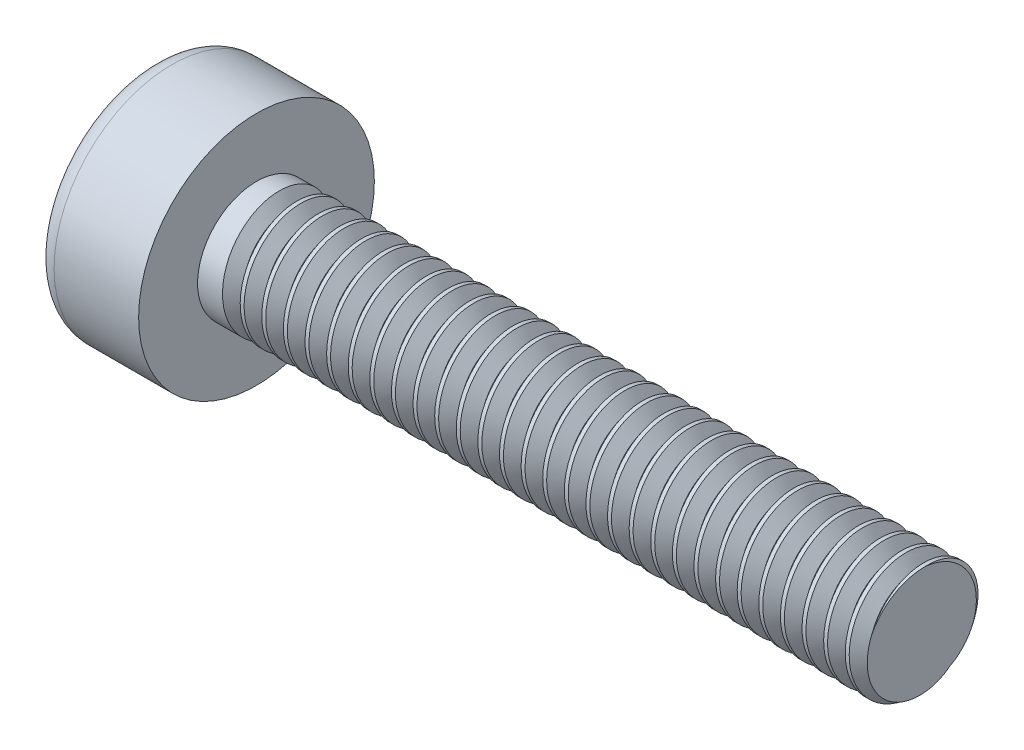
from build123d import *

# Parameters (mm, degrees)
CUT_EXTRUDE1_DEPTH = 3.5
CUT_EXTRUDE1_DRAFT = 10
CUT_SWEEP1_PITCH   = 1.1
FILLET2_R          = 1
CUT_EXTRUDE2_DEPTH = 3.5


with BuildPart() as part:
    # Sketch1 → Revolve1 (revolve)
    with BuildSketch(Plane.XY, mode=Mode.PRIVATE) as revolve1_sk:
        with BuildLine():
            Line((0, 3), (34, 3))
            Line((34, 3), (34, 0))
            Line((34, 0), (0, 0))
            Line((0, 0), (-5.5, 0))
            ThreePointArc((-5.5, 0), (-5.71228207, 3.038523506), (-5, 6))
            Line((-5, 6), (0, 6))
            Line((0, 6), (0, 3))
        make_face()
    revolve(revolve1_sk.sketch.rotate(Axis((34, 0, 0), (-1, 0, 0)), 90), axis=Axis((34, 0, 0), (-1, 0, 0)))


with BuildPart() as cut_extrude1_tool:
    # Sketch4 → Cut-Extrude1 (with draft: the straight prism first)
    with BuildSketch(Plane(origin=(-6, 0, 0), x_dir=(0, 0, -1), z_dir=(1, 0, 0))):
        with BuildLine():
            Line((-3.6, 0.71), (-3.6, -0.71))
            Line((-3.6, -0.71), (-1.433840995, -0.71))
            ThreePointArc((-1.433840995, -0.71), (-1.13137085, -1.13137085), (-0.71, -1.433840995))
            Line((-0.71, -1.433840995), (-0.71, -3.6))
            Line((-0.71, -3.6), (0.71, -3.6))
            Line((0.71, -3.6), (0.71, -1.433840995))
            ThreePointArc((0.71, -1.433840995), (1.13137085, -1.13137085), (1.433840995, -0.71))
            Line((1.433840995, -0.71), (3.6, -0.71))
            Line((3.6, -0.71), (3.6, 0.71))
            Line((3.6, 0.71), (1.433840995, 0.71))
            ThreePointArc((1.433840995, 0.71), (1.13137085, 1.13137085), (0.71, 1.433840995))
            Line((0.71, 1.433840995), (0.71, 3.6))
            Line((0.71, 3.6), (-0.71, 3.6))
            Line((-0.71, 3.6), (-0.71, 1.433840995))
            ThreePointArc((-0.71, 1.433840995), (-1.13137085, 1.13137085), (-1.433840995, 0.71))
            Line((-1.433840995, 0.71), (-3.6, 0.71))
        make_face()
    extrude(amount=CUT_EXTRUDE1_DEPTH)
    # Cut-Extrude1: the draft: its side faces are tilted about the plane it starts from
    cut_extrude1_sides = [cut_extrude1_tool.faces().sort_by_distance(p)[0] for p in [
        (-4.25, 0.71, 2.516920498),
        (-4.25, 0, 3.6),
        (-4.25, -0.71, 2.516920498),
        (-4.25, -1.13137085, 1.13137085),
        (-4.25, -2.516920498, 0.71),
        (-4.25, -3.6, 0),
        (-4.25, -2.516920498, -0.71),
        (-4.25, -1.13137085, -1.13137085),
        (-4.25, -0.71, -2.516920498),
        (-4.25, 0, -3.6),
        (-4.25, 0.71, -2.516920498),
        (-4.25, 1.13137085, -1.13137085),
        (-4.25, 2.516920498, -0.71),
        (-4.25, 3.6, 0),
        (-4.25, 2.516920498, 0.71),
        (-4.25, 1.13137085, 1.13137085),
    ]]
    draft(cut_extrude1_sides, Plane(origin=(-6, 0, 0), x_dir=(0, 0, -1), z_dir=(1, 0, 0)), CUT_EXTRUDE1_DRAFT)


with BuildPart() as part_1:
    add(part.part)

    # Cut-Extrude1: cut by cut_extrude1_tool
    add(cut_extrude1_tool.part, mode=Mode.SUBTRACT)

    # Cut-Sweep1: the profile of Sketch6 profile screwed along a right-hand helix of 30.454545 turns, 8 arcs to a turn; built about Z, then put on its axis
    cut_sweep1_z = Axis((0, 0, 0), (0, 0, 1))
    cut_sweep1_corners = [(3.0003, 0, 0.000225), (3.0003, 0, -0.900225), (2.4, 0, -0.45)]
    with BuildLine(mode=Mode.PRIVATE) as cut_sweep1_profile:
        Line(cut_sweep1_corners[0], cut_sweep1_corners[1])
        Line(cut_sweep1_corners[1], cut_sweep1_corners[2])
        Line(cut_sweep1_corners[2], cut_sweep1_corners[0])
    cut_sweep1_cap = Face(cut_sweep1_profile.wire())
    cut_sweep1_turn_angles = [0, 22.5, 45, 67.5, 90, 112.5, 135, 157.5, 180, 202.5, 225, 247.5, 270, 292.5, 315, 337.5, 360]
    cut_sweep1_turn_weights = [1, 0.9238795325112867, 1, 0.9238795325112867, 1, 0.9238795325112867, 1, 0.9238795325112867, 1, 0.9238795325112867, 1, 0.9238795325112867, 1, 0.9238795325112867, 1, 0.9238795325112867, 1]
    cut_sweep1_turn_rails = [Edge.make_bspline([Vector(p[0], p[1], 0).rotate(cut_sweep1_z, cut_sweep1_turn_angles[k]) / cut_sweep1_turn_weights[k] + Vector(0, 0, p[2] + CUT_SWEEP1_PITCH * cut_sweep1_turn_angles[k] / 360) for k in range(17)], [0, 0, 0, 1, 1, 2, 2, 3, 3, 4, 4, 5, 5, 6, 6, 7, 7, 8, 8, 8], 2, cut_sweep1_turn_weights) for p in cut_sweep1_corners]
    cut_sweep1_turn_sides = [Face.make_surface_from_curves(cut_sweep1_turn_rails[p[0]], cut_sweep1_turn_rails[p[1]]) for p in [(0, 1), (1, 2), (2, 0)]]
    cut_sweep1_last_angles = [10800, 10822.5, 10845, 10867.5, 10890, 10912.5, 10935, 10949.318181818, 10963.636363637]
    cut_sweep1_last_weights = [1, 0.9238795325112867, 1, 0.9238795325112867, 1, 0.9238795325112867, 1, 0.968937301781173, 1]
    cut_sweep1_last_rails = [Edge.make_bspline([Vector(p[0], p[1], 0).rotate(cut_sweep1_z, cut_sweep1_last_angles[k]) / cut_sweep1_last_weights[k] + Vector(0, 0, p[2] + CUT_SWEEP1_PITCH * cut_sweep1_last_angles[k] / 360) for k in range(9)], [0, 0, 0, 1, 1, 2, 2, 3, 3, 4, 4, 4], 2, cut_sweep1_last_weights) for p in cut_sweep1_corners]
    cut_sweep1_last_sides = [Face.make_surface_from_curves(cut_sweep1_last_rails[p[0]], cut_sweep1_last_rails[p[1]]) for p in [(0, 1), (1, 2), (2, 0)]]
    cut_sweep1 = Plane(origin=(34, 0, 0), x_dir=(0, 1, 0), z_dir=(-1, 0, 0)) * Solid(Shell([*[p.moved(Location((0, 0, CUT_SWEEP1_PITCH * i))) for i in range(30) for p in cut_sweep1_turn_sides], *cut_sweep1_last_sides, cut_sweep1_cap, cut_sweep1_cap.rotate(cut_sweep1_z, 10963.636363637).moved(Location((0, 0, CUT_SWEEP1_PITCH * 10963.636363637 / 360)))]))
    add(cut_sweep1, mode=Mode.SUBTRACT)

    # Fillet2
    fillet2_edges = [part_1.edges().sort_by_distance(p)[0] for p in [
        (-5, 0, 6),
    ]]
    fillet(fillet2_edges, radius=FILLET2_R)

    # Sketch7 → Cut-Extrude2 (cut)
    with BuildSketch(Plane(origin=(0, 0, 0), x_dir=(-1.0, 1.0116180489300965e-09, -3.4451402334639366e-09), z_dir=(3.5905935867420422e-09, 0.2817411730097801, -0.9594904436371804))):
        Polygon((-0.949547062, -2.4), (-1.399547638, -3), (-0.499547638, -3), align=None)
    extrude(amount=-CUT_EXTRUDE2_DEPTH, mode=Mode.SUBTRACT)


solid = part_1.part
